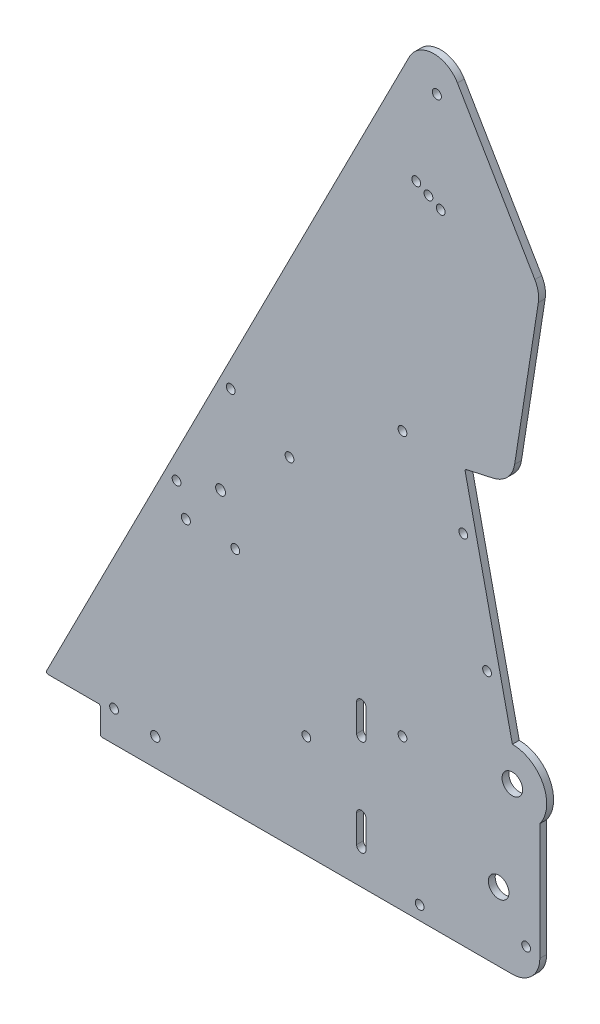
from build123d import *

# Parameters (mm, degrees)
BOSS_EXTRUDE1_DEPTH = 3.175
SKETCH2_R           = 2.0955
SKETCH2_R_2         = 2.286
SKETCH2_R_3         = 2.032
SKETCH2_R_4         = 4.7625
CUT_EXTRUDE1_DEPTH  = 421.976111717
SKETCH7_R           = 2.159
CUT_EXTRUDE2_DEPTH  = 421.976111717
CUT_EXTRUDE3_REACH  = 422.976
SKETCH10_R          = 2.032
FILLET1_R           = 12.7
FILLET2_R           = 0.79375
SKETCH12_R          = 2.032
CUT_EXTRUDE5_DEPTH  = 410.593447353


with BuildPart() as part:
    # Sketch1 → Boss-Extrude1 (new body)
    with BuildSketch(Plane.XY):
        with BuildLine():
            Line((228.6, -12.7), (228.6, 53.975))
            ThreePointArc((228.6, 53.975), (230.099031657, 70.599515829), (215.9, 79.375))
            Line((215.9, 79.375), (193.909735224, 178.566674323))
            Line((193.909735224, 178.566674323), (215.607913982, 183.377044743))
            Line((215.607913982, 183.377044743), (228.6, 266.7))
            Line((228.6, 266.7), (178.754725958, 351.413083686))
            Line((178.754725958, 351.413083686), (0, 0))
            Line((0, 0), (25.4, 0))
            Line((25.4, 0), (25.4, -12.7))
            Line((25.4, -12.7), (228.6, -12.7))
        make_face()
    extrude(amount=BOSS_EXTRUDE1_DEPTH)

    # Sketch2 → Cut-Extrude1 (cut, through all)
    with BuildSketch(Plane.XY.offset(3.175)):
        with Locations((64.943150167, 94.057839899)):
            Circle(SKETCH2_R)
        with Locations((180.975, 322.164313376)):
            Circle(SKETCH2_R)
        with Locations((81.00705334, 113.73297687)):
            Circle(SKETCH2_R_2)
        with Locations((193.207821773, 152.394364194)):
            Circle(SKETCH2_R_3)
        with Locations((215.9, 63.5)):
            Circle(SKETCH2_R_4)
        with Locations((173.0375, -6.35)):
            Circle(SKETCH2_R_3)
        with Locations((204.202954161, 102.798527032)):
            Circle(SKETCH2_R_3)
        with Locations((209.55, 19.05)):
            Circle(SKETCH2_R_4)
        with Locations((60.657757175, 107.341986975)):
            Circle(SKETCH2_R_3)
        with Locations((165.1, 179.3875)):
            Circle(SKETCH2_R_3)
        with Locations((87.824985877, 93.522721993)):
            Circle(SKETCH2_R_3)
        with Locations((112.872403657, 142.763324016)):
            Circle(SKETCH2_R_3)
        with Locations((85.705174955, 156.582588998)):
            Circle(SKETCH2_R_3)
        with Locations((171.45, 282.575)):
            Circle(SKETCH2_R_3)
        with Locations((177.109839313, 279.695986462)):
            Circle(SKETCH2_R_3)
        with Locations((182.769678626, 276.816972924)):
            Circle(SKETCH2_R_3)
    extrude(amount=-CUT_EXTRUDE1_DEPTH, mode=Mode.SUBTRACT)

    # Sketch7 → Cut-Extrude2 (cut, through all)
    with BuildSketch(Plane.XY.offset(3.175)):
        with Locations((50.8, 0)):
            Circle(SKETCH7_R)
        with BuildLine():
            Line((143.891, 3.175), (143.891, 15.875))
            ThreePointArc((143.891, 15.875), (146.05, 18.034), (148.209, 15.875))
            Line((148.209, 15.875), (148.209, 3.175))
            ThreePointArc((148.209, 3.175), (146.05, 1.016), (143.891, 3.175))
        make_face()
        with BuildLine():
            Line((143.891, 47.625), (143.891, 60.325))
            ThreePointArc((143.891, 60.325), (146.05, 62.484), (148.209, 60.325))
            Line((148.209, 60.325), (148.209, 47.625))
            ThreePointArc((148.209, 47.625), (146.05, 45.466), (143.891, 47.625))
        make_face()
    extrude(amount=-CUT_EXTRUDE2_DEPTH, mode=Mode.SUBTRACT)

    # Sketch10 → Cut-Extrude3 (cut, up to next)
    with BuildSketch(Plane.XY.offset(3.175), mode=Mode.PRIVATE) as cut_extrude3_sk1:
        with Locations((120.65, 34.925)):
            Circle(SKETCH10_R)
    cut_extrude3_tool1 = extrude(cut_extrude3_sk1.sketch, amount=-CUT_EXTRUDE3_REACH, mode=Mode.PRIVATE) & part.part
    # Sketch10 → Cut-Extrude3 (cut, up to next)
    with BuildSketch(Plane.XY.offset(3.175), mode=Mode.PRIVATE) as cut_extrude3_sk2:
        with Locations((165.1, 57.15)):
            Circle(SKETCH10_R)
    cut_extrude3_tool2 = extrude(cut_extrude3_sk2.sketch, amount=-CUT_EXTRUDE3_REACH, mode=Mode.PRIVATE) & part.part
    add(cut_extrude3_tool1.solids().sort_by_distance((120.65, 34.925, 3.175))[0], mode=Mode.SUBTRACT)
    add(cut_extrude3_tool2.solids().sort_by_distance((165.1, 57.15, 3.175))[0], mode=Mode.SUBTRACT)

    # Fillet1
    fillet1_edges = [part.edges().sort_by_distance(p)[0] for p in [
        (228.6, -12.7, 1.5875),
        (178.754725958, 351.413083686, 1.5875),
        (215.607913982, 183.377044743, 1.5875),
        (228.6, 266.7, 1.5875),
    ]]
    fillet(fillet1_edges, radius=FILLET1_R)

    # Fillet2
    fillet2_edges = [part.edges().sort_by_distance(p)[0] for p in [
        (25.4, -12.7, 1.5875),
        (25.4, 0, 1.5875),
        (193.909735224, 178.566674323, 1.5875),
        (0, 0, 1.5875),
    ]]
    fillet(fillet2_edges, radius=FILLET2_R)

    # Sketch12 → Cut-Extrude5 (cut, through all)
    with BuildSketch(Plane.XY.offset(3.175)):
        with Locations((31.75, 1.5875)):
            Circle(SKETCH12_R)
        with Locations((173.0375, -6.35)):
            Circle(SKETCH12_R)
        with Locations((222.25, 1.5875)):
            Circle(SKETCH12_R)
    extrude(amount=-CUT_EXTRUDE5_DEPTH, mode=Mode.SUBTRACT)


solid = part.part
